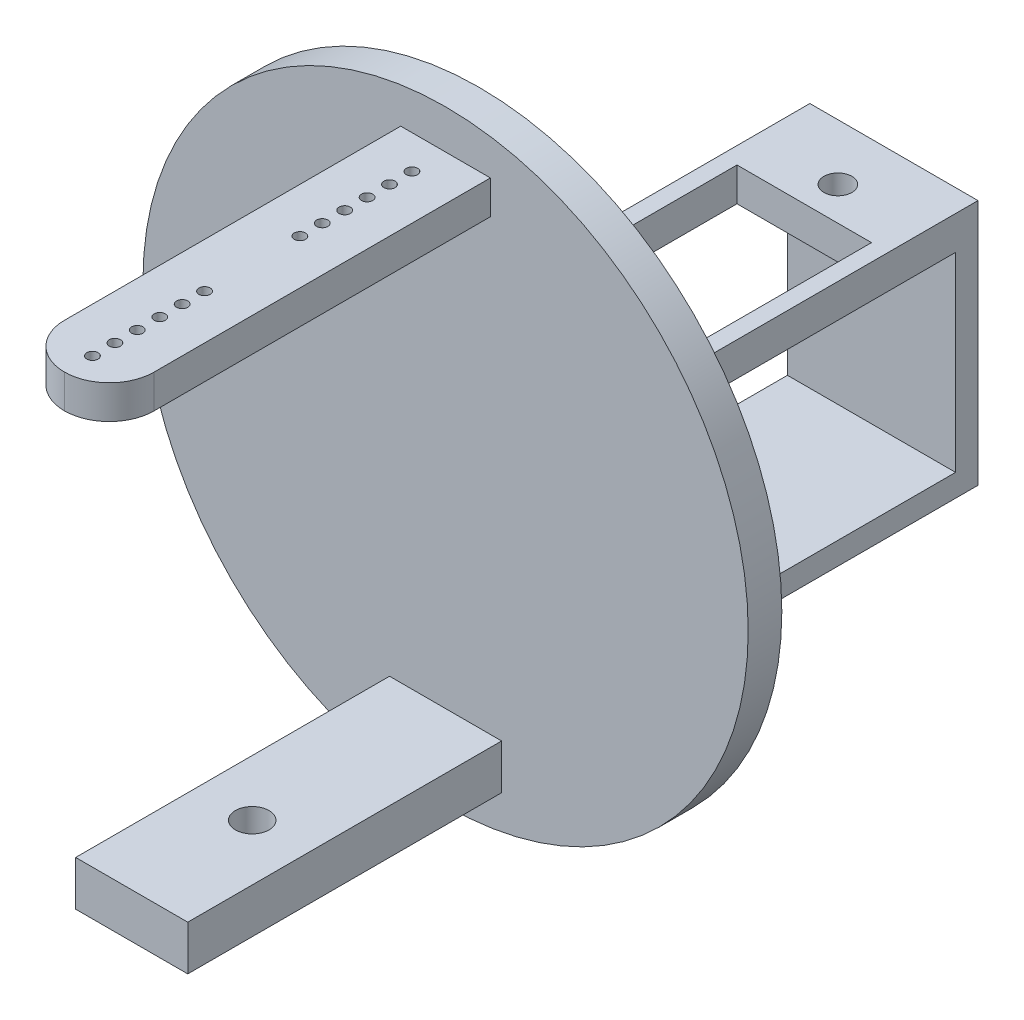
from build123d import *

# Parameters (mm, degrees)
SKETCH1_R           = 27
BOSS_EXTRUDE1_DEPTH = 3
SKETCH2_W           = 8
SKETCH2_H           = 3
BOSS_EXTRUDE2_DEPTH = 34
SKETCH5_R           = 0.5
CUT_EXTRUDE1_DEPTH  = 5
FILLET1_R           = 4
SKETCH6_W           = 15
SKETCH6_H           = 3
BOSS_EXTRUDE3_DEPTH = 35
SKETCH7_R           = 1.25
SKETCH7_W           = 12
SKETCH7_H           = 23
CUT_EXTRUDE2_DEPTH  = 5
SKETCH8_W           = 15
SKETCH8_H           = 20
BOSS_EXTRUDE4_DEPTH = 2
SKETCH9_W           = 15
SKETCH9_H           = 37
BOSS_EXTRUDE5_DEPTH = 2
SKETCH10_W          = 10
SKETCH10_H          = 4
BOSS_EXTRUDE6_DEPTH = 28
SKETCH11_R          = 1.5
CUT_EXTRUDE3_DEPTH  = 5
SKETCH12_R          = 1.5
BOSS_EXTRUDE7_DEPTH = 5


with BuildPart() as part:
    # Sketch1 → Boss-Extrude1 (new body)
    with BuildSketch(Plane.XY):
        Circle(SKETCH1_R)
    extrude(amount=BOSS_EXTRUDE1_DEPTH)

    # Sketch2 → Boss-Extrude2 (add)
    with BuildSketch(Plane.XY.offset(3)):
        with Locations((0, 22)):
            Rectangle(SKETCH2_W, SKETCH2_H)
    extrude(amount=BOSS_EXTRUDE2_DEPTH)

    # Sketch5 → Cut-Extrude1 (cut)
    with BuildSketch(Plane(origin=(0, 23.5, 0), x_dir=(1, 0, 0), z_dir=(0, 1, 0))):
        with Locations(Location((0, -6, 0), (0, 0, 270))):
            Circle(SKETCH5_R)
        with Locations(Location((0, -8, 0), (0, 0, 270))):
            Circle(SKETCH5_R)
        with Locations(Location((0, -10, 0), (0, 0, 270))):
            Circle(SKETCH5_R)
        with Locations(Location((0, -12, 0), (0, 0, 270))):
            Circle(SKETCH5_R)
        with Locations(Location((0, -14, 0), (0, 0, 270))):
            Circle(SKETCH5_R)
        with Locations(Location((0, -16, 0), (0, 0, 270))):
            Circle(SKETCH5_R)
        with Locations(Location((0, -34.5, 0), (0, 0, 270))):
            Circle(SKETCH5_R)
        with Locations(Location((0, -32.5, 0), (0, 0, 270))):
            Circle(SKETCH5_R)
        with Locations(Location((0, -30.5, 0), (0, 0, 270))):
            Circle(SKETCH5_R)
        with Locations(Location((0, -28.5, 0), (0, 0, 270))):
            Circle(SKETCH5_R)
        with Locations(Location((0, -26.5, 0), (0, 0, 270))):
            Circle(SKETCH5_R)
        with Locations(Location((0, -24.5, 0), (0, 0, 270))):
            Circle(SKETCH5_R)
    extrude(amount=-CUT_EXTRUDE1_DEPTH, mode=Mode.SUBTRACT)

    # Fillet1
    fillet1_edges = [part.edges().sort_by_distance(p)[0] for p in [
        (-4, 22, 37),
        (4, 22, 37),
    ]]
    fillet(fillet1_edges, radius=FILLET1_R - 0.0001)  # a hair under: the kernel refuses the full size

    # Sketch6 → Boss-Extrude3 (add)
    with BuildSketch(Plane(origin=(0, 0, 0), x_dir=(-1, 0, 0), z_dir=(0, 0, -1))):
        with Locations((0, 2)):
            Rectangle(SKETCH6_W, SKETCH6_H)
    extrude(amount=BOSS_EXTRUDE3_DEPTH)

    # Sketch7 → Cut-Extrude2 (cut)
    with BuildSketch(Plane(origin=(0, 3.5, 0), x_dir=(1, 0, 0), z_dir=(0, 1, 0))):
        with Locations(Location((0, 32, 0), (0, 0, 270))):
            Circle(SKETCH7_R)
        with Locations(Location((0, 3, 0), (0, 0, 270))):
            Circle(SKETCH7_R)
        with Locations((0, 17.5)):
            Rectangle(SKETCH7_W, SKETCH7_H)
    extrude(amount=-CUT_EXTRUDE2_DEPTH, mode=Mode.SUBTRACT)

    # Sketch8 → Boss-Extrude4 (add)
    with BuildSketch(Plane(origin=(0, 0, -35), x_dir=(-1, 0, 0), z_dir=(0, 0, -1))):
        with Locations((0, -6.5)):
            Rectangle(SKETCH8_W, SKETCH8_H)
    extrude(amount=BOSS_EXTRUDE4_DEPTH)

    # Sketch9 → Boss-Extrude5 (add)
    with BuildSketch(Plane.XZ.offset(16.5)):
        with Locations((0, -18.5)):
            Rectangle(SKETCH9_W, SKETCH9_H)
    extrude(amount=BOSS_EXTRUDE5_DEPTH)

    # Sketch10 → Boss-Extrude6 (add)
    with BuildSketch(Plane.XY.offset(3)):
        with Locations((0, -21.5)):
            Rectangle(SKETCH10_W, SKETCH10_H)
    extrude(amount=BOSS_EXTRUDE6_DEPTH)

    # Sketch11 → Cut-Extrude3 (cut)
    with BuildSketch(Plane(origin=(0, -19.5, 0), x_dir=(1, 0, 0), z_dir=(0, 1, 0))):
        with Locations(Location((0, -20.25, 0), (0, 0, 270))):
            Circle(SKETCH11_R)
    extrude(amount=-CUT_EXTRUDE3_DEPTH, mode=Mode.SUBTRACT)

    # Sketch12 → Boss-Extrude7 (add)
    with BuildSketch(Plane.XZ.offset(18.5)):
        with Locations(Location((0, -22.5, 0), (0, 0, 270))):
            Circle(SKETCH12_R)
    extrude(amount=BOSS_EXTRUDE7_DEPTH)


solid = part.part
